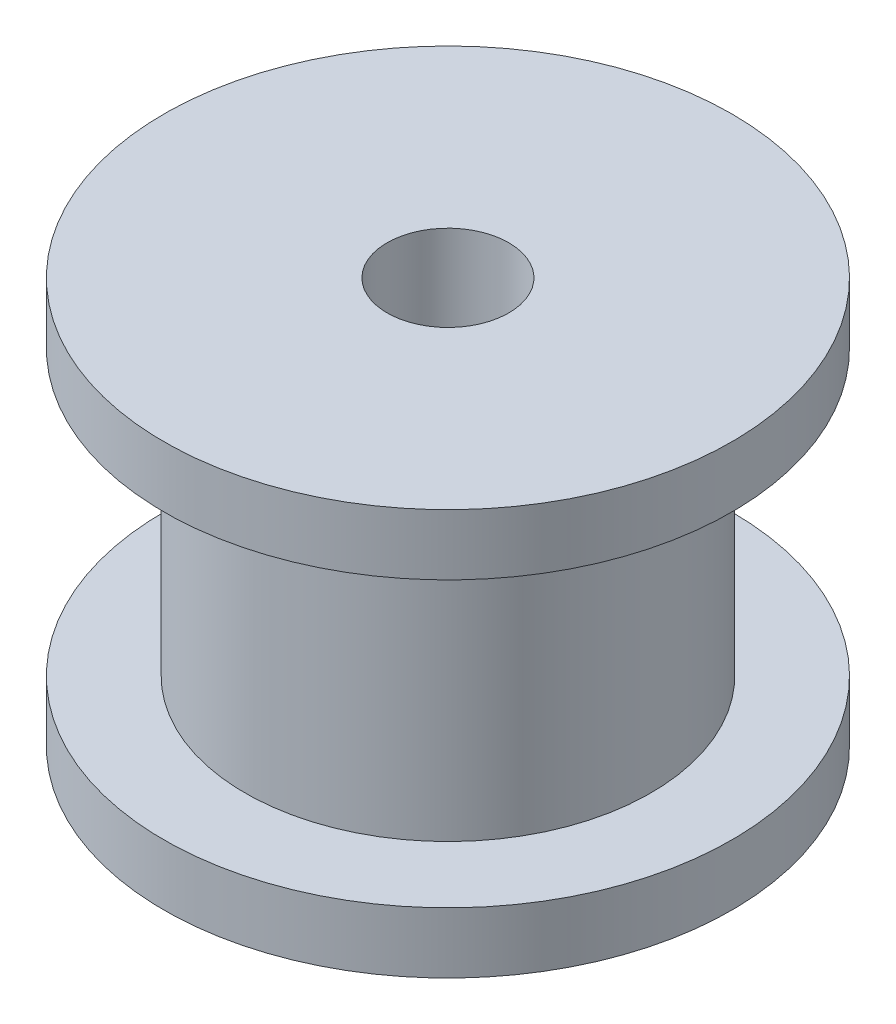
from build123d import *


with BuildPart() as part:
    # Sketch1 → Revolve1 (revolve)
    with BuildSketch(Plane.XY):
        Polygon((1.5, 0), (7, 0), (7, 1.5), (5, 1.5), (5, 8.5), (7, 8.5), (7, 10), (1.5, 10), align=None)
    revolve(axis=Axis((0, 0, 0), (0, 1, 0)))


solid = part.part
